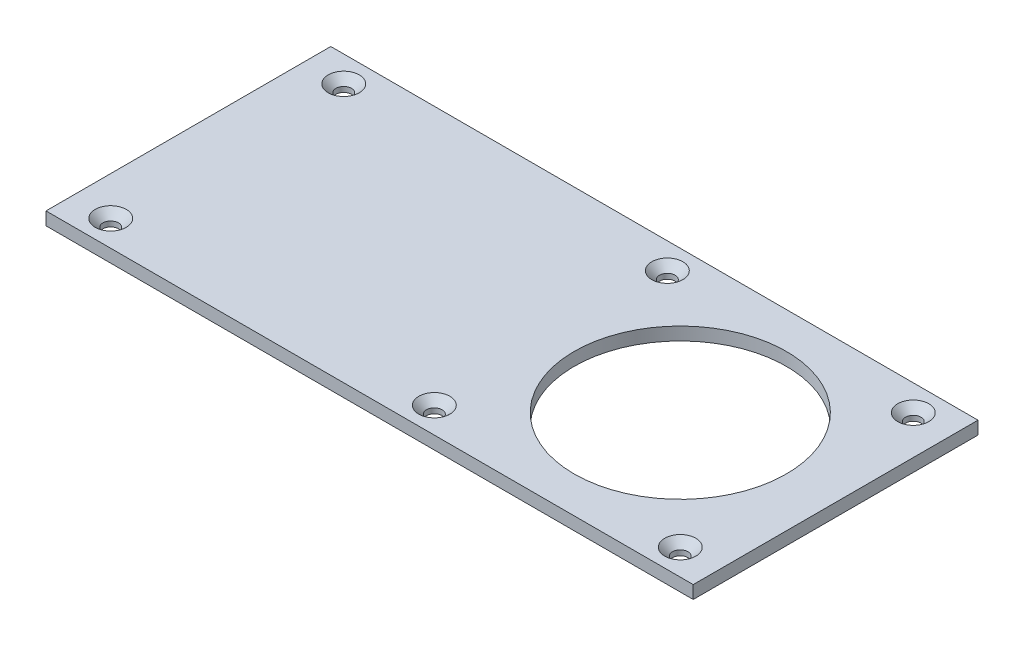
from build123d import *

# Parameters (mm, degrees)
SKETCH_1_W          = 250
SKETCH_1_H          = 110
SKETCH_1_R          = 41
EXTRUDE_1_DEPTH     = 5
SKETCH_2_R          = 3
CUT_EXTRUDE_1_DEPTH = 137.656503687
CHAMFER_1_SIZE      = 3


with BuildPart() as part:
    # Эскиз1 → Бобышка-Вытянуть1 (new body)
    with BuildSketch(Plane(origin=(0, 0, 0), x_dir=(1, 0, 0), z_dir=(0, 1, 0))):
        Rectangle(SKETCH_1_W, SKETCH_1_H)
        with Locations((65, 0)):
            Circle(SKETCH_1_R, mode=Mode.SUBTRACT)
    extrude(amount=EXTRUDE_1_DEPTH)

    # Эскиз2 → Вырез-Вытянуть1 (cut, through all)
    with BuildSketch(Plane(origin=(0, 5, 0), x_dir=(1, 0, 0), z_dir=(0, 1, 0))):
        with Locations((110, -45)):
            Circle(SKETCH_2_R)
        with Locations((-110, -45)):
            Circle(SKETCH_2_R)
        with Locations((15, -45)):
            Circle(SKETCH_2_R)
        with Locations((-110, 45)):
            Circle(SKETCH_2_R)
        with Locations((15, 45)):
            Circle(SKETCH_2_R)
        with Locations((110, 45)):
            Circle(SKETCH_2_R)
    extrude(amount=-CUT_EXTRUDE_1_DEPTH, mode=Mode.SUBTRACT)

    # Фаска1
    chamfer_1_edges = [part.edges().sort_by_distance(p)[0] for p in [
        (-113, 5, 45),
        (107, 5, -45),
        (12, 5, -45),
        (12, 5, 45),
        (107, 5, 45),
        (-113, 5, -45),
    ]]
    chamfer(chamfer_1_edges, length=CHAMFER_1_SIZE)


solid = part.part
